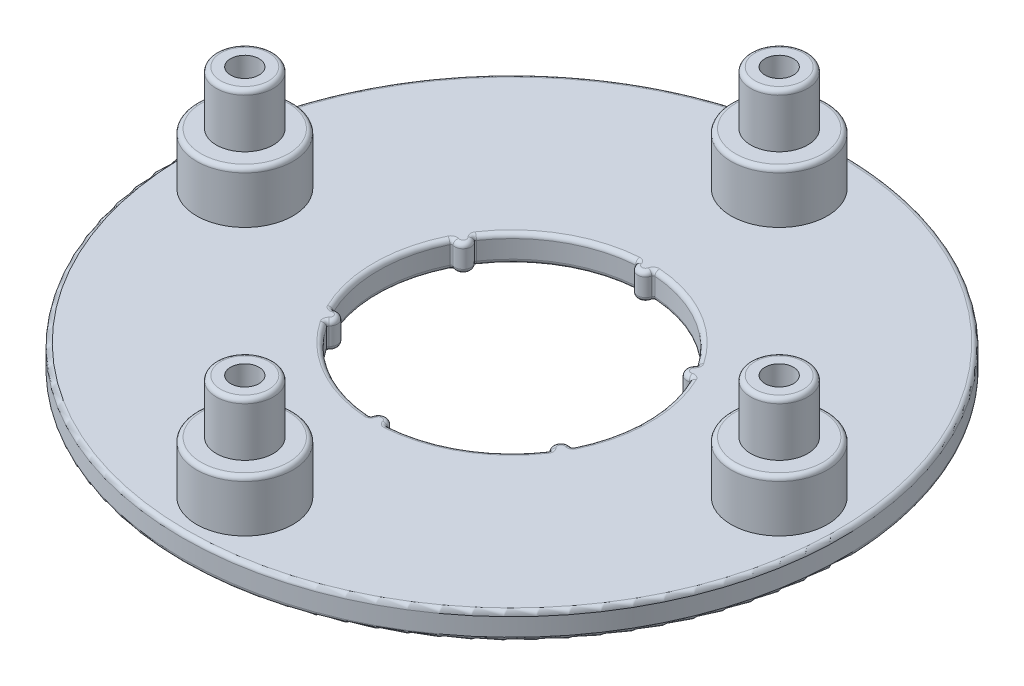
from build123d import *

# Parameters (mm, degrees)
SKETCH_1_R               = 37
EXTRUDE_1_DEPTH          = 3
CUT_EXTRUDE_1_DEPTH      = 53.411830726
SKETCH_3_R               = 5.4
EXTRUDE_2_DEPTH          = 5.8
SKETCH_4_R               = 3.2
EXTRUDE_3_DEPTH          = 6
PATTERN_CIRCULAR_1_COUNT = 4
FILLET_1_R               = 0.5
FILLET_2_R               = 0.5


# Read off the part's stored shape, not the designer's step: 高级异型孔1
with BuildPart() as part:
    # 草图1 → 凸台-拉伸1 (new body)
    with BuildSketch(Plane(origin=(0, 0, 0), x_dir=(1, 0, 0), z_dir=(0, 1, 0))):
        with Locations(Location((0, 0, 0), (0, 0, 270))):
            Circle(SKETCH_1_R)
    extrude(amount=EXTRUDE_1_DEPTH)

    # 草图2 → 切除-拉伸1 (cut, through all)
    with BuildSketch(Plane(origin=(0, 3, 0), x_dir=(1, 0, 0), z_dir=(0, 1, 0))):
        with BuildLine():
            ThreePointArc((-1.088231788, 14.960472973), (-7.5, 12.990381057), (-12.412033753, 8.42267286))
            ThreePointArc((-12.412033753, 8.42267286), (-12.445196264, 8.287225866), (-12.381783804, 8.163030455))
            ThreePointArc((-12.381783804, 8.163030455), (-12.210958193, 7.05), (-13.260283647, 6.641424091))
            ThreePointArc((-13.260283647, 6.641424091), (-13.399546259, 6.634243187), (-13.500265541, 6.537800113))
            ThreePointArc((-13.500265541, 6.537800113), (-15, 0), (-13.500265541, -6.537800113))
            ThreePointArc((-13.500265541, -6.537800113), (-13.399546259, -6.634243187), (-13.260283647, -6.641424091))
            ThreePointArc((-13.260283647, -6.641424091), (-12.210958193, -7.05), (-12.381783804, -8.163030455))
            ThreePointArc((-12.381783804, -8.163030455), (-12.445196264, -8.287225866), (-12.412033753, -8.42267286))
            ThreePointArc((-12.412033753, -8.42267286), (-7.5, -12.990381057), (-1.088231788, -14.960472973))
            ThreePointArc((-1.088231788, -14.960472973), (-0.954349995, -14.921469053), (-0.878499844, -14.804454545))
            ThreePointArc((-0.878499844, -14.804454545), (0, -14.1), (0.878499844, -14.804454545))
            ThreePointArc((0.878499844, -14.804454545), (0.954349995, -14.921469053), (1.088231788, -14.960472973))
            ThreePointArc((1.088231788, -14.960472973), (7.5, -12.990381057), (12.412033753, -8.42267286))
            ThreePointArc((12.412033753, -8.42267286), (12.445196264, -8.287225866), (12.381783804, -8.163030455))
            ThreePointArc((12.381783804, -8.163030455), (12.210958193, -7.05), (13.260283647, -6.641424091))
            ThreePointArc((13.260283647, -6.641424091), (13.399546259, -6.634243187), (13.500265541, -6.537800113))
            ThreePointArc((13.500265541, -6.537800113), (15, 0), (13.500265541, 6.537800113))
            ThreePointArc((13.500265541, 6.537800113), (13.399546259, 6.634243187), (13.260283647, 6.641424091))
            ThreePointArc((13.260283647, 6.641424091), (12.210958193, 7.05), (12.381783804, 8.163030455))
            ThreePointArc((12.381783804, 8.163030455), (12.445196264, 8.287225866), (12.412033753, 8.42267286))
            ThreePointArc((12.412033753, 8.42267286), (7.5, 12.990381057), (1.088231788, 14.960472973))
            ThreePointArc((1.088231788, 14.960472973), (0.954349995, 14.921469053), (0.878499844, 14.804454545))
            ThreePointArc((0.878499844, 14.804454545), (0, 14.1), (-0.878499844, 14.804454545))
            ThreePointArc((-0.878499844, 14.804454545), (-0.954349995, 14.921469053), (-1.088231788, 14.960472973))
        make_face()
    extrude(amount=-CUT_EXTRUDE_1_DEPTH, mode=Mode.SUBTRACT)

    # 草图3 → 凸台-拉伸2 (add)
    with BuildSketch(Plane(origin=(0, 3, 0), x_dir=(1, 0, 0), z_dir=(0, 1, 0))):
        with Locations(Location((0, 30, 0), (0, 0, 270))):
            Circle(SKETCH_3_R)
        with Locations(Location((30, 0, 0), (0, 0, 270))):
            Circle(SKETCH_3_R)
        with Locations(Location((0, -30, 0), (0, 0, 270))):
            Circle(SKETCH_3_R)
        with Locations(Location((-30, 0, 0), (0, 0, 270))):
            Circle(SKETCH_3_R)
    extrude(amount=EXTRUDE_2_DEPTH)

    # 草图4 → 凸台-拉伸3 (add)
    with BuildSketch(Plane(origin=(0, 8.8, 0), x_dir=(1, 0, 0), z_dir=(0, 1, 0))):
        with Locations(Location((0, 30, 0), (0, 0, 270))):
            Circle(SKETCH_4_R)
        with Locations(Location((30, 0, 0), (0, 0, 270))):
            Circle(SKETCH_4_R)
        with Locations(Location((0, -30, 0), (0, 0, 270))):
            Circle(SKETCH_4_R)
        with Locations(Location((-30, 0, 0), (0, 0, 270))):
            Circle(SKETCH_4_R)
    extrude(amount=EXTRUDE_3_DEPTH)

    # 高级异型孔1 outline → 高级异型孔1 (revolve, cut)
    with BuildSketch(Plane.XY.offset(30)):
        Polygon((0, 0), (3.3, 0), (1.6, 1.7), (1.6, 14.8), (0, 14.8), align=None)
    other_1 = revolve(axis=Axis((0, 0, 30), (0, 1, 0)), mode=Mode.SUBTRACT)

    # 阵列(圆周)1: 高级异型孔1 ×4 about axis
    pattern_circular_1_axis = Axis((0, 0, 0), (0, 1, 0))
    for i in range(1, PATTERN_CIRCULAR_1_COUNT):
        add(other_1.rotate(pattern_circular_1_axis, i * 360 / PATTERN_CIRCULAR_1_COUNT), mode=Mode.SUBTRACT)

    # 圆角1
    fillet_1_edges = [part.edges().sort_by_distance(p)[0] for p in [
        (0.954349995, 0, -14.921469053),
        (7.5, 0, -12.990381057),
        (12.445196264, 0, -8.287225866),
        (12.210958193, 0, -7.05),
        (13.399546259, 0, -6.634243187),
        (15, 0, 0),
        (13.399546259, 0, 6.634243187),
        (12.210958193, 0, 7.05),
        (12.445196264, 0, 8.287225866),
        (7.5, 0, 12.990381057),
        (0.954349995, 0, 14.921469053),
        (0, 0, 14.1),
        (-0.954349995, 0, 14.921469053),
        (-7.5, 0, 12.990381057),
        (-12.445196264, 0, 8.287225866),
        (-12.210958193, 0, 7.05),
        (-13.399546259, 0, 6.634243187),
        (-15, 0, 0),
        (-13.399546259, 0, -6.634243187),
        (-12.210958193, 0, -7.05),
        (-12.445196264, 0, -8.287225866),
        (-7.5, 0, -12.990381057),
        (-0.954349995, 0, -14.921469053),
        (0, 0, -14.1),
        (0.954349995, 3, -14.921469053),
        (0, 3, -14.1),
        (-0.954349995, 3, -14.921469053),
        (-7.5, 3, -12.990381057),
        (-12.445196264, 3, -8.287225866),
        (-12.210958193, 3, -7.05),
        (-13.399546259, 3, -6.634243187),
        (-15, 3, 0),
        (-13.399546259, 3, 6.634243187),
        (-12.210958193, 3, 7.05),
        (-12.445196264, 3, 8.287225866),
        (-7.5, 3, 12.990381057),
        (-0.954349995, 3, 14.921469053),
        (0, 3, 14.1),
        (0.954349995, 3, 14.921469053),
        (7.5, 3, 12.990381057),
        (12.445196264, 3, 8.287225866),
        (12.210958193, 3, 7.05),
        (13.399546259, 3, 6.634243187),
        (15, 3, 0),
        (13.399546259, 3, -6.634243187),
        (12.210958193, 3, -7.05),
        (12.445196264, 3, -8.287225866),
        (7.5, 3, -12.990381057),
    ]]
    fillet(fillet_1_edges, radius=FILLET_1_R)

    # 圆角2
    fillet_2_edges = [part.edges().sort_by_distance(p)[0] for p in [
        (0, 14.8, -33.2),
        (30, 14.8, -3.2),
        (0, 14.8, 26.8),
        (-30, 14.8, -3.2),
        (0, 0, -37),
        (0, 3, -37),
        (0, 8.8, -35.4),
        (30, 8.8, -5.4),
        (0, 8.8, 24.6),
        (-30, 8.8, -5.4),
    ]]
    fillet(fillet_2_edges, radius=FILLET_2_R)


solid = part.part
